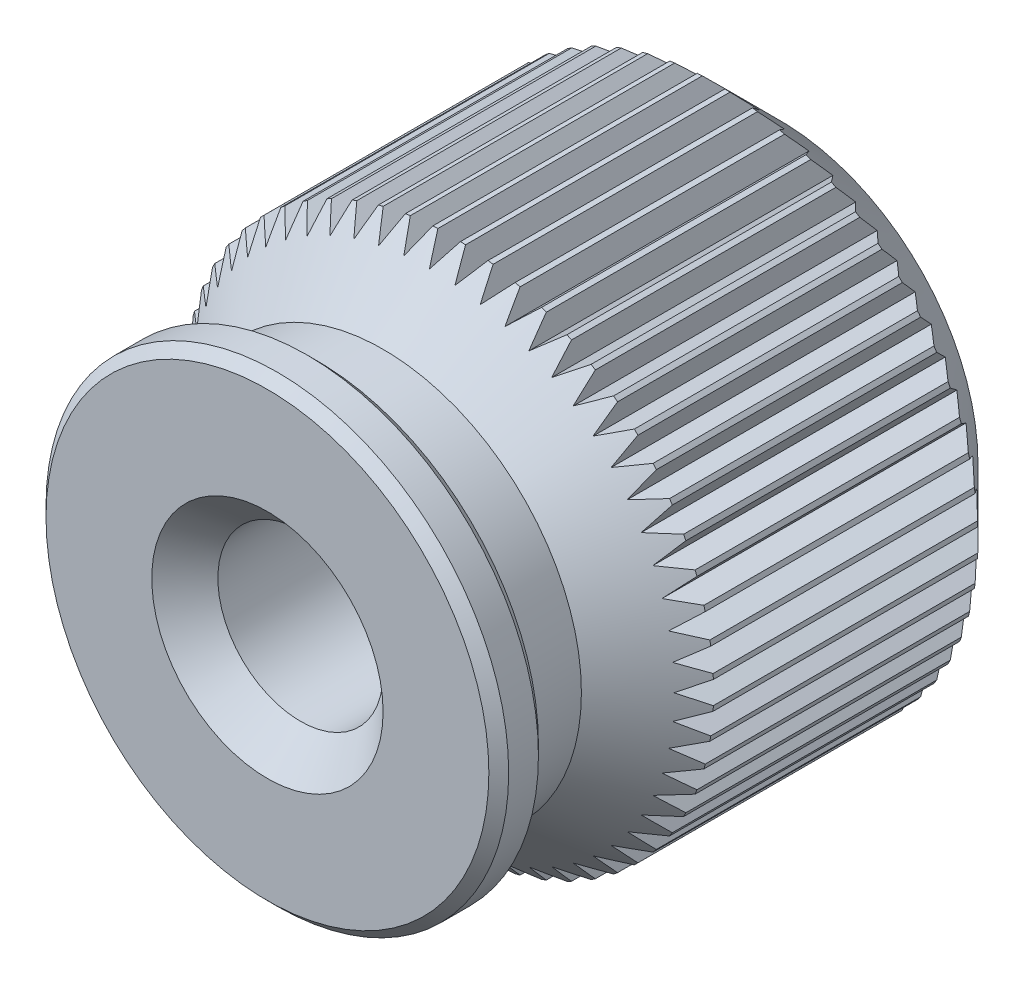
from build123d import *

# Parameters (mm, degrees)
SKETCH_1_R               = 8
EXTRUDE_1_DEPTH          = 12
SKETCH_2_R               = 6
EXTRUDE_2_DEPTH          = 2
SKETCH_3_R               = 2.5
CUT_EXTRUDE_1_DEPTH      = 14
CHAMFER_1_SIZE           = 1
CHAMFER_2_SIZE           = 2
EXTRUDE_START            = 1.5
SKETCH_4_R               = 7
SKETCH_4_R_2             = 2.5
EXTRUDE_3_DEPTH          = 1.5
CHAMFER_3_SIZE           = 1
CHAMFER_4_SIZE           = 0.3
CUT_EXTRUDE_2_DEPTH      = 20
PATTERN_CIRCULAR_1_COUNT = 60


with BuildPart() as part:
    # Эскиз1 → Вытянуть1 (new body)
    with BuildSketch(Plane.XY):
        Circle(SKETCH_1_R)
    extrude(amount=EXTRUDE_1_DEPTH)

    # Эскиз2 → Вытянуть2 (add)
    with BuildSketch(Plane.XY.offset(12)):
        Circle(SKETCH_2_R)
    extrude(amount=EXTRUDE_2_DEPTH)

    # Эскиз3 → Вырез-Вытянуть1 (cut)
    with BuildSketch(Plane.XY.offset(14)):
        Circle(SKETCH_3_R)
    extrude(amount=-CUT_EXTRUDE_1_DEPTH, mode=Mode.SUBTRACT)

    # Фаска1
    chamfer_1_edges = [part.edges().sort_by_distance(p)[0] for p in [
        (-2.5, 0, 0),
    ]]
    chamfer(chamfer_1_edges, length=CHAMFER_1_SIZE)

    # Фаска2
    chamfer_2_edges = [part.edges().sort_by_distance(p)[0] for p in [
        (-8, 0, 0),
        (-8, 0, 12),
    ]]
    chamfer(chamfer_2_edges, length=CHAMFER_2_SIZE - 0.0001)  # a hair under: the kernel refuses the full size

    # Эскиз4 → Вытянуть3 (add)
    with BuildSketch(Plane.XY.offset(14).offset(EXTRUDE_START)):
        Circle(SKETCH_4_R)
        Circle(SKETCH_4_R_2, mode=Mode.SUBTRACT)
    extrude(amount=-EXTRUDE_3_DEPTH)

    # Фаска3
    chamfer_3_edges = [part.edges().sort_by_distance(p)[0] for p in [
        (-2.5, 0, 15.5),
    ]]
    chamfer(chamfer_3_edges, length=CHAMFER_3_SIZE)

    # Фаска4
    chamfer_4_edges = [part.edges().sort_by_distance(p)[0] for p in [
        (-7, 0, 15.5),
        (-7, 0, 14),
    ]]
    chamfer(chamfer_4_edges, length=CHAMFER_4_SIZE)

    # Эскиз5 → Вырез-Вытянуть2 (cut)
    with BuildSketch(Plane.XY.offset(15.5)):
        Polygon((0, 7.4), (-0.688816959, 8.59306597), (0.688816959, 8.59306597), align=None)
    cut_extrude_2 = extrude(amount=-CUT_EXTRUDE_2_DEPTH, mode=Mode.SUBTRACT)

    # Круговой массив1: Вырез-Вытянуть2 ×60 about axis
    pattern_circular_1_axis = Axis((0, 0, 0), (0, 0, -1))
    for i in range(1, PATTERN_CIRCULAR_1_COUNT):
        add(cut_extrude_2.rotate(pattern_circular_1_axis, i * 360 / PATTERN_CIRCULAR_1_COUNT), mode=Mode.SUBTRACT)


solid = part.part
